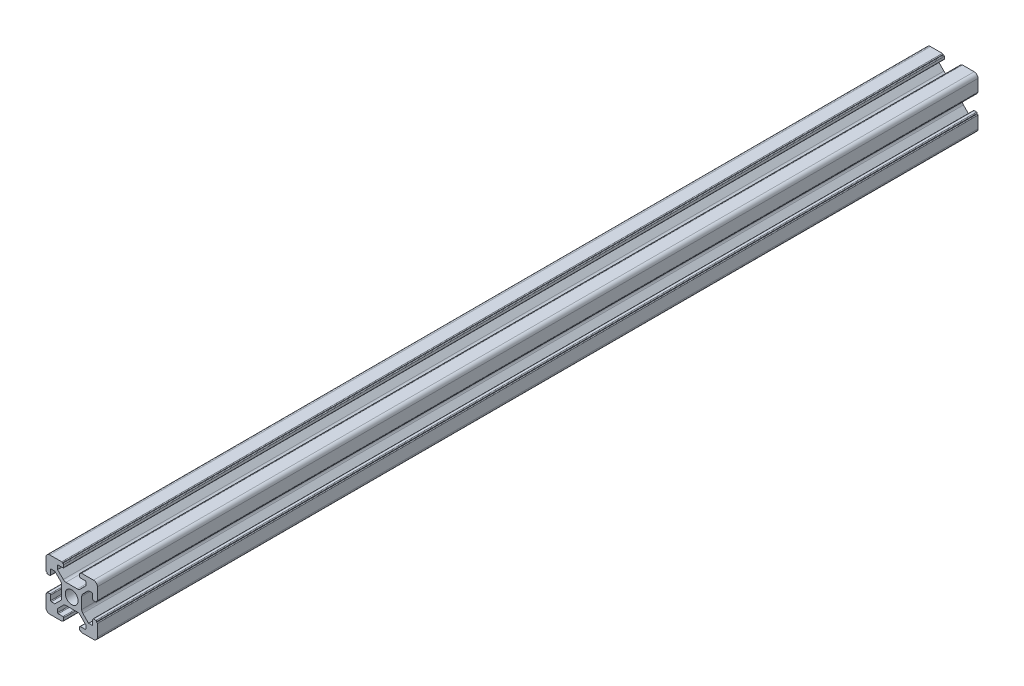
from build123d import *

# Parameters (mm, degrees)
BOSS_EXTRUDE1_DEPTH = 342.9
F_3DSKETCH2_R       = 2.5
CUT_EXTRUDE1_DEPTH  = 344.191605484


with BuildPart() as part:
    # Sketch1 → Boss-Extrude1 (new body)
    with BuildSketch(Plane.XY):
        with BuildLine():
            ThreePointArc((-4.339541497, 3.27832502), (-4.01438237, 2.791689997), (-3.900201668, 2.217664848))
            Line((-3.900201668, 2.217664848), (-3.900201668, -2.220777458))
            ThreePointArc((-3.900201668, -2.220777458), (-4.013982246, -2.793835668), (-4.338062619, -3.279956687))
            ThreePointArc((-4.338062619, -3.279956687), (-4.338801799, -3.280697416), (-4.339541497, -3.28143763))
            Line((-4.339541497, -3.28143763), (-6.559305445, -5.501201578))
            Line((-6.559305445, -5.501201578), (-7.918645273, -5.501201578))
            ThreePointArc((-7.918645273, -5.501201578), (-8.116635172, -5.419191476), (-8.198645273, -5.221201578))
            Line((-8.198645273, -5.221201578), (-8.198645273, -3.381201578))
            ThreePointArc((-8.198645273, -3.381201578), (-8.280655374, -3.183211679), (-8.478645273, -3.101201578))
            Line((-8.478645273, -3.101201578), (-9.418645273, -3.101201578))
            ThreePointArc((-9.418645273, -3.101201578), (-9.616635172, -3.183211679), (-9.698645273, -3.381201578))
            Line((-9.698645273, -3.381201578), (-9.698645273, -3.601201578))
            Line((-9.698645273, -3.601201578), (-9.718645273, -3.601201578))
            ThreePointArc((-9.718645273, -3.601201578), (-9.916635172, -3.683211679), (-9.998645273, -3.881201578))
            Line((-9.998645273, -3.881201578), (-9.998645273, -8.501201578))
            ThreePointArc((-9.998645273, -8.501201578), (-9.559305445, -9.561861749), (-8.498645273, -10.001201578))
            Line((-8.498645273, -10.001201578), (-3.878645273, -10.001201578))
            ThreePointArc((-3.878645273, -10.001201578), (-3.680655374, -9.919191476), (-3.598645273, -9.721201578))
            Line((-3.598645273, -9.721201578), (-3.598645273, -9.701201578))
            Line((-3.598645273, -9.701201578), (-3.378645273, -9.701201578))
            ThreePointArc((-3.378645273, -9.701201578), (-3.180655374, -9.619191476), (-3.098645273, -9.421201578))
            Line((-3.098645273, -9.421201578), (-3.098645273, -8.481201578))
            ThreePointArc((-3.098645273, -8.481201578), (-3.180655374, -8.283211679), (-3.378645273, -8.201201578))
            Line((-3.378645273, -8.201201578), (-5.218645273, -8.201201578))
            ThreePointArc((-5.218645273, -8.201201578), (-5.416635172, -8.119191476), (-5.498645273, -7.921201578))
            Line((-5.498645273, -7.921201578), (-5.498645273, -6.561861749))
            Line((-5.498645273, -6.561861749), (-3.277324929, -4.340541406))
            ThreePointArc((-3.277324929, -4.340541406), (-2.790689906, -4.015382279), (-2.216664757, -3.901201578))
            Line((-2.216664757, -3.901201578), (2.234977304, -3.899793498))
            ThreePointArc((2.234977304, -3.899793498), (2.801097117, -4.016727825), (3.280957809, -4.339061494))
            Line((3.280957809, -4.339061494), (5.502201668, -6.560305354))
            Line((5.502201668, -6.560305354), (5.502201668, -7.919645182))
            ThreePointArc((5.502201668, -7.919645182), (5.420191567, -8.117635081), (5.222201668, -8.199645182))
            Line((5.222201668, -8.199645182), (3.382201668, -8.199645182))
            ThreePointArc((3.382201668, -8.199645182), (3.18421177, -8.281655283), (3.102201668, -8.479645182))
            Line((3.102201668, -8.479645182), (3.102201668, -9.419645182))
            ThreePointArc((3.102201668, -9.419645182), (3.18421177, -9.617635081), (3.382201668, -9.699645182))
            Line((3.382201668, -9.699645182), (3.602201668, -9.699645182))
            Line((3.602201668, -9.699645182), (3.602201668, -9.719645182))
            ThreePointArc((3.602201668, -9.719645182), (3.68421177, -9.917635081), (3.882201668, -9.999645182))
            Line((3.882201668, -9.999645182), (8.502201668, -9.999645182))
            ThreePointArc((8.502201668, -9.999645182), (9.56286184, -9.560305354), (10.002201668, -8.499645182))
            Line((10.002201668, -8.499645182), (10.002201668, -3.879645182))
            ThreePointArc((10.002201668, -3.879645182), (9.920191567, -3.681655283), (9.722201668, -3.599645182))
            Line((9.722201668, -3.599645182), (9.702201668, -3.599645182))
            Line((9.702201668, -3.599645182), (9.702201668, -3.379645182))
            ThreePointArc((9.702201668, -3.379645182), (9.620191567, -3.181655283), (9.422201668, -3.099645182))
            Line((9.422201668, -3.099645182), (8.482201668, -3.099645182))
            ThreePointArc((8.482201668, -3.099645182), (8.28421177, -3.181655283), (8.202201668, -3.379645182))
            Line((8.202201668, -3.379645182), (8.202201668, -5.219645182))
            ThreePointArc((8.202201668, -5.219645182), (8.120191567, -5.417635081), (7.922201668, -5.499645182))
            Line((7.922201668, -5.499645182), (6.56286184, -5.499645182))
            Line((6.56286184, -5.499645182), (4.341541497, -3.278324838))
            ThreePointArc((4.341541497, -3.278324838), (4.01638237, -2.791689815), (3.902201668, -2.217664667))
            Line((3.902201668, -2.217664667), (3.900793589, 2.233977395))
            ThreePointArc((3.900793589, 2.233977395), (4.017727916, 2.800097207), (4.340061585, 3.2799579))
            Line((4.340061585, 3.2799579), (6.561305445, 5.501201759))
            Line((6.561305445, 5.501201759), (7.920645273, 5.501201759))
            ThreePointArc((7.920645273, 5.501201759), (8.118635172, 5.419191658), (8.200645273, 5.221201759))
            Line((8.200645273, 5.221201759), (8.200645273, 3.381201759))
            ThreePointArc((8.200645273, 3.381201759), (8.282655374, 3.183211861), (8.480645273, 3.101201759))
            Line((8.480645273, 3.101201759), (9.420645273, 3.101201759))
            ThreePointArc((9.420645273, 3.101201759), (9.618635172, 3.183211861), (9.700645273, 3.381201759))
            Line((9.700645273, 3.381201759), (9.700645273, 3.601201759))
            Line((9.700645273, 3.601201759), (9.720645273, 3.601201759))
            ThreePointArc((9.720645273, 3.601201759), (9.918635172, 3.683211861), (10.000645273, 3.881201759))
            Line((10.000645273, 3.881201759), (10.000645273, 8.501201759))
            ThreePointArc((10.000645273, 8.501201759), (9.561305445, 9.561861931), (8.500645273, 10.001201759))
            Line((8.500645273, 10.001201759), (3.880645273, 10.001201759))
            ThreePointArc((3.880645273, 10.001201759), (3.682655374, 9.919191658), (3.600645273, 9.721201759))
            Line((3.600645273, 9.721201759), (3.600645273, 9.701201759))
            Line((3.600645273, 9.701201759), (3.380645273, 9.701201759))
            ThreePointArc((3.380645273, 9.701201759), (3.182655374, 9.619191658), (3.100645273, 9.421201759))
            Line((3.100645273, 9.421201759), (3.100645273, 8.481201759))
            ThreePointArc((3.100645273, 8.481201759), (3.182655374, 8.283211861), (3.380645273, 8.201201759))
            Line((3.380645273, 8.201201759), (5.220645273, 8.201201759))
            ThreePointArc((5.220645273, 8.201201759), (5.418635172, 8.119191658), (5.500645273, 7.921201759))
            Line((5.500645273, 7.921201759), (5.500645273, 6.561861931))
            Line((5.500645273, 6.561861931), (3.279324929, 4.340541588))
            ThreePointArc((3.279324929, 4.340541588), (2.792689906, 4.015382461), (2.218664757, 3.901201759))
            Line((2.218664757, 3.901201759), (-2.232977304, 3.89979368))
            ThreePointArc((-2.232977304, 3.89979368), (-2.799097117, 4.016728006), (-3.278957809, 4.339061676))
            Line((-3.278957809, 4.339061676), (-5.500201668, 6.560305535))
            Line((-5.500201668, 6.560305535), (-5.500201668, 7.919645364))
            ThreePointArc((-5.500201668, 7.919645364), (-5.418191567, 8.117635262), (-5.220201668, 8.199645364))
            Line((-5.220201668, 8.199645364), (-3.380201668, 8.199645364))
            ThreePointArc((-3.380201668, 8.199645364), (-3.18221177, 8.281655465), (-3.100201668, 8.479645364))
            Line((-3.100201668, 8.479645364), (-3.100201668, 9.419645364))
            ThreePointArc((-3.100201668, 9.419645364), (-3.18221177, 9.617635262), (-3.380201668, 9.699645364))
            Line((-3.380201668, 9.699645364), (-3.600201668, 9.699645364))
            Line((-3.600201668, 9.699645364), (-3.600201668, 9.719645364))
            ThreePointArc((-3.600201668, 9.719645364), (-3.68221177, 9.917635262), (-3.880201668, 9.999645364))
            Line((-3.880201668, 9.999645364), (-8.500201668, 9.999645364))
            ThreePointArc((-8.500201668, 9.999645364), (-9.56086184, 9.560305535), (-10.000201668, 8.499645364))
            Line((-10.000201668, 8.499645364), (-10.000201668, 3.879645364))
            ThreePointArc((-10.000201668, 3.879645364), (-9.918191567, 3.681655465), (-9.720201668, 3.599645364))
            Line((-9.720201668, 3.599645364), (-9.700201668, 3.599645364))
            Line((-9.700201668, 3.599645364), (-9.700201668, 3.379645364))
            ThreePointArc((-9.700201668, 3.379645364), (-9.618191567, 3.181655465), (-9.420201668, 3.099645364))
            Line((-9.420201668, 3.099645364), (-8.480201668, 3.099645364))
            ThreePointArc((-8.480201668, 3.099645364), (-8.28221177, 3.181655465), (-8.200201668, 3.379645364))
            Line((-8.200201668, 3.379645364), (-8.200201668, 5.219645364))
            ThreePointArc((-8.200201668, 5.219645364), (-8.118191567, 5.417635262), (-7.920201668, 5.499645364))
            Line((-7.920201668, 5.499645364), (-6.56086184, 5.499645364))
            Line((-6.56086184, 5.499645364), (-4.339541497, 3.27832502))
        make_face()
    extrude(amount=BOSS_EXTRUDE1_DEPTH)

    # 3DSketch2 → Cut-Extrude1 (cut, through all)
    with BuildSketch(Plane.XY):
        Circle(F_3DSKETCH2_R)
    extrude(amount=CUT_EXTRUDE1_DEPTH, mode=Mode.SUBTRACT)


solid = part.part
